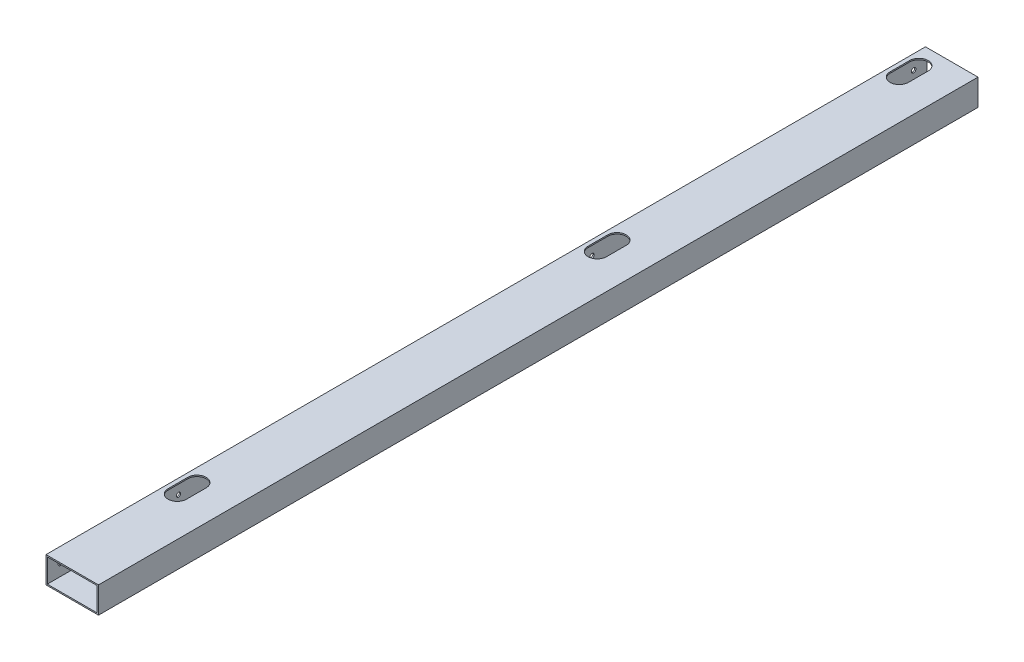
from build123d import *

# Parameters (mm, degrees)
SKETCH_1_W             = 40
SKETCH_1_H             = 20
SKETCH_1_W_2           = 38
SKETCH_1_H_2           = 18
EXTRUDE_1_DEPTH        = 670
SKETCH_4_R             = 1.75
CUT_EXTRUDE_2_DEPTH    = 1.5
SKETCH_8_R             = 1.65
CUT_EXTRUDE_3_DEPTH    = 5
SKETCH_9_R             = 1.6
CUT_EXTRUDE_4_DEPTH    = 10
CUT_EXTRUDE_5_DEPTH    = 10
PATTERN_LINEAR_1_COUNT = 2
PATTERN_LINEAR_1_PITCH = 230


with BuildPart() as part:
    # 草图1 → 拉伸-薄壁1 (new body)
    with BuildSketch(Plane.XY):
        with Locations((20, -10)):
            Rectangle(SKETCH_1_W, SKETCH_1_H)
        with Locations((20, -10)):
            Rectangle(SKETCH_1_W_2, SKETCH_1_H_2, mode=Mode.SUBTRACT)
    extrude(amount=EXTRUDE_1_DEPTH)

    # 草图4 → 切除-拉伸2 (cut)
    with BuildSketch(Plane.ZY):
        with Locations((659.996387591, -10)):
            Circle(SKETCH_4_R)
        with Locations((10, -10.000000002)):
            Circle(SKETCH_4_R)
    extrude(amount=-CUT_EXTRUDE_2_DEPTH, mode=Mode.SUBTRACT)

    # 草图8 → 切除-拉伸3 (cut)
    with BuildSketch(Plane.ZY):
        with Locations((45, -10)):
            Circle(SKETCH_8_R)
        with Locations((255, -10)):
            Circle(SKETCH_8_R)
    extrude(amount=-CUT_EXTRUDE_3_DEPTH, mode=Mode.SUBTRACT)

    # 草图9 → 切除-拉伸4 (cut)
    with BuildSketch(Plane.ZY):
        with Locations((570, -10)):
            Circle(SKETCH_9_R)
    extrude(amount=-CUT_EXTRUDE_4_DEPTH, mode=Mode.SUBTRACT)

    # 草图10 → 切除-拉伸5 (cut)
    with BuildSketch(Plane(origin=(0, 0, 0), x_dir=(1, 0, 0), z_dir=(0, 1, 0))):
        with BuildLine():
            Line((3, -580), (3, -565))
            ThreePointArc((3, -565), (10, -558), (17, -565))
            Line((17, -565), (17, -580))
            ThreePointArc((17, -580), (10, -587), (3, -580))
        make_face()
        with BuildLine():
            Line((3, -30), (3, -15))
            ThreePointArc((3, -15), (10, -8), (17, -15))
            Line((17, -15), (17, -30))
            ThreePointArc((17, -30), (10, -37), (3, -30))
        make_face()
    cut_extrude_5 = extrude(amount=-CUT_EXTRUDE_5_DEPTH, mode=Mode.SUBTRACT)

    # 阵列(线性)1: 切除-拉伸5 ×2
    with Locations(*[(0, 0, i * PATTERN_LINEAR_1_PITCH) for i in range(1, PATTERN_LINEAR_1_COUNT)]):
        add(cut_extrude_5, mode=Mode.SUBTRACT)


solid = part.part
